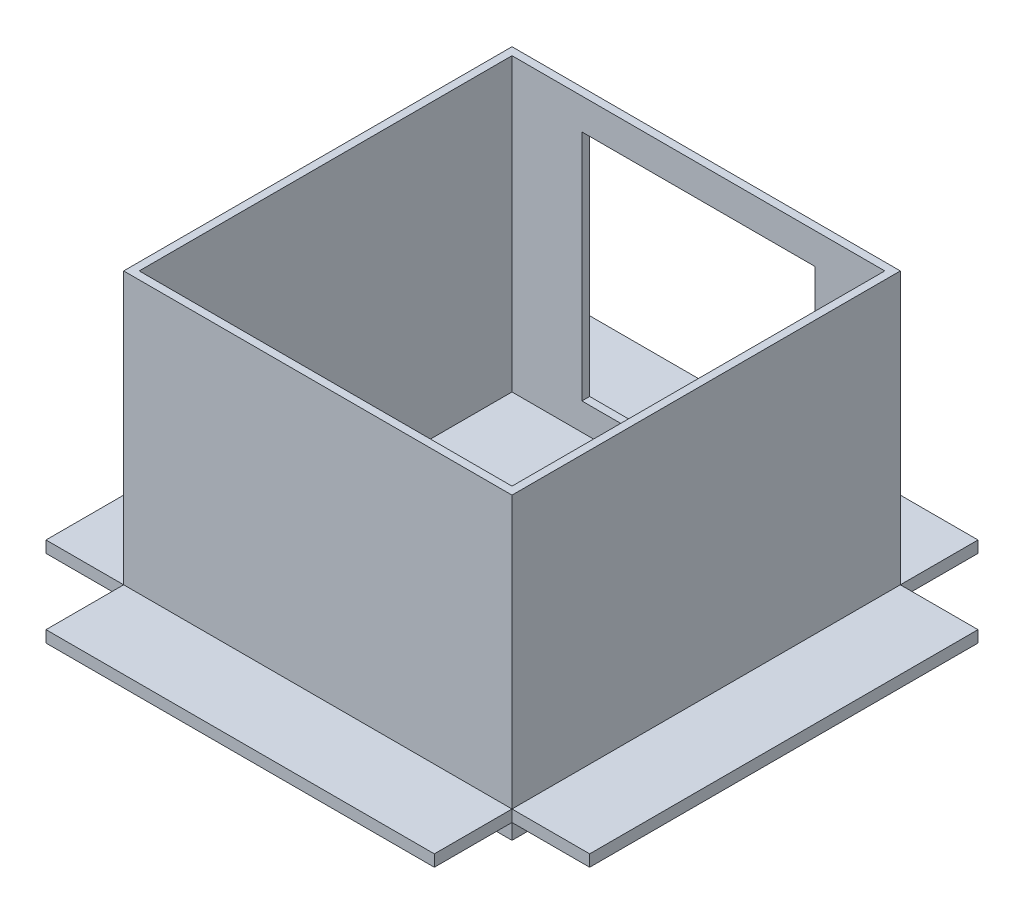
from build123d import *

# Parameters (mm, degrees)
SKETCH1_W                = 20
SKETCH1_H                = 100
BOSS_EXTRUDE1_DEPTH      = 3
BOSS_EXTRUDE2_DEPTH      = 70
BOSS_EXTRUDE2_DEPTH_BACK = 7
SKETCH2_W                = 100
SKETCH2_H                = 100
SHELL1_START             = -2
SHELL1_OUTLINE_W         = 96
SHELL1_OUTLINE_H         = 96
SHELL1_DEPTH             = 75
SKETCH3_W                = 80
SKETCH3_H                = 10
CUT_EXTRUDE1_DEPTH       = 11
SKETCH6_W                = 60
SKETCH6_H                = 60
CUT_EXTRUDE2_DEPTH       = 2


# Read off the part's stored shape, not the designer's step: Shell1
with BuildPart() as part:
    # Sketch1 → Boss-Extrude1 (new body)
    with BuildSketch(Plane(origin=(0, 0, 0), x_dir=(1, 0, 0), z_dir=(0, 1, 0))):
        Polygon((0, 50), (-50, 50), (-50, -50), (0, -50), (50, -50), (50, 0), (50, 50), align=None)
        with Locations((-60, 0)):
            Rectangle(SKETCH1_W, SKETCH1_H)
        Polygon((0, -50), (-50, -50), (-50, -70), (0, -70), (50, -70), (50, -50), align=None)
        Polygon((70, 50), (50, 50), (50, 0), (50, -50), (70, -50), (70, 0), align=None)
        Polygon((-50, 70), (-50, 50), (0, 50), (50, 50), (50, 70), (0, 70), align=None)
    extrude(amount=BOSS_EXTRUDE1_DEPTH)

    # Sketch2 → Boss-Extrude2 (add, two sides: drawn at the far end of the back side and taken through both)
    with BuildSketch(Plane(origin=(0, 3, 0), x_dir=(-1, 0, 0), z_dir=(0, 1, 0)).offset(-BOSS_EXTRUDE2_DEPTH_BACK)):
        Rectangle(SKETCH2_W, SKETCH2_H)
    extrude(amount=BOSS_EXTRUDE2_DEPTH + BOSS_EXTRUDE2_DEPTH_BACK)

    # Shell1 outline → Shell1 (cut)
    with BuildSketch(Plane(origin=(0, 0, 0), x_dir=(1, 0, 0), z_dir=(0, 1, 0)).offset(SHELL1_START)):
        Rectangle(SHELL1_OUTLINE_W, SHELL1_OUTLINE_H)
    extrude(amount=SHELL1_DEPTH, mode=Mode.SUBTRACT)

    # Sketch3 → Cut-Extrude1 (cut)
    with BuildSketch(Plane.XZ.offset(4)):
        with Locations((0, 35)):
            Rectangle(SKETCH3_W, SKETCH3_H)
    extrude(amount=-CUT_EXTRUDE1_DEPTH, mode=Mode.SUBTRACT)

    # Sketch6 → Cut-Extrude2 (cut)
    with BuildSketch(Plane(origin=(0, 0, -50), x_dir=(-1, 0, 0), z_dir=(0, 0, -1))):
        with Locations((0, 35)):
            Rectangle(SKETCH6_W, SKETCH6_H)
    extrude(amount=-CUT_EXTRUDE2_DEPTH, mode=Mode.SUBTRACT)


solid = part.part
